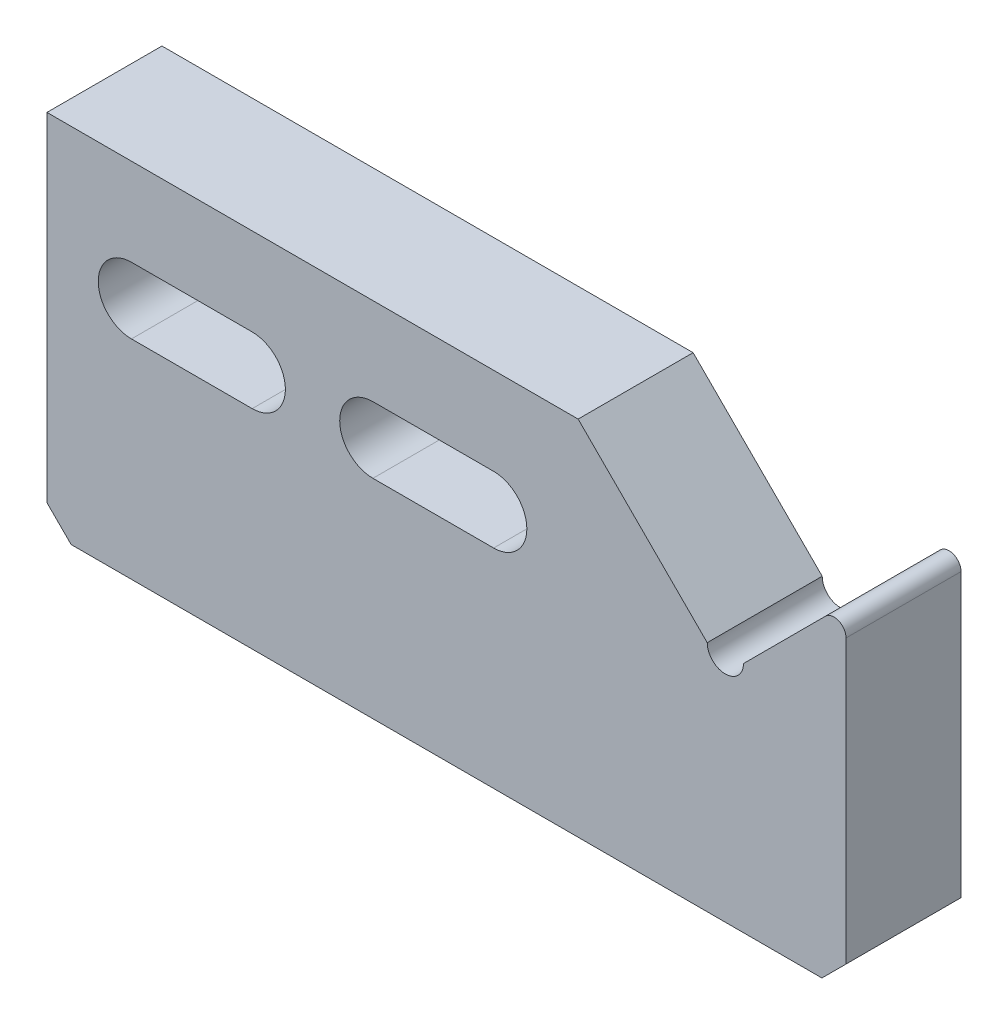
from build123d import *

# Parameters (mm, degrees)
BOSS_EXTRUDE1_DEPTH      = 6
BOSS_EXTRUDE1_DEPTH_BACK = 3.525
FILLET1_R                = 1
CHAMFER1_SIZE            = 2
CHAMFER2_SIZE            = 0.5


with BuildPart() as part:
    # Sketch1 → Boss-Extrude1 (new, two sides: drawn at the far end of the back side and taken through both)
    with BuildSketch(Plane.XY.offset(-BOSS_EXTRUDE1_DEPTH_BACK)):
        with BuildLine():
            Line((-10, 267.218866814), (-18.5, 258.718866814))
            ThreePointArc((-18.5, 258.718866814), (-20, 257.218866814), (-21.5, 258.718866814))
            Line((-21.5, 258.718866814), (-32.192388155, 269.41125497))
            Line((-32.192388155, 269.41125497), (-76.192388155, 269.41125497))
            Line((-76.192388155, 269.41125497), (-76.192388155, 239.41125497))
            Line((-76.192388155, 239.41125497), (-10, 239.41125497))
            Line((-10, 239.41125497), (-10, 267.218866814))
        make_face()
        with BuildLine():
            Line((-59.192388155, 262.16125497), (-69.192388155, 262.16125497))
            ThreePointArc((-69.192388155, 262.16125497), (-71.942388155, 259.41125497), (-69.192388155, 256.66125497))
            Line((-69.192388155, 256.66125497), (-59.192388155, 256.66125497))
            ThreePointArc((-59.192388155, 256.66125497), (-56.442388155, 259.41125497), (-59.192388155, 262.16125497))
        make_face(mode=Mode.SUBTRACT)
        with BuildLine():
            Line((-39.192388155, 262.16125497), (-49.192388155, 262.16125497))
            ThreePointArc((-49.192388155, 262.16125497), (-51.942388155, 259.41125497), (-49.192388155, 256.66125497))
            Line((-49.192388155, 256.66125497), (-39.192388155, 256.66125497))
            ThreePointArc((-39.192388155, 256.66125497), (-36.442388155, 259.41125497), (-39.192388155, 262.16125497))
        make_face(mode=Mode.SUBTRACT)
    extrude(amount=BOSS_EXTRUDE1_DEPTH + BOSS_EXTRUDE1_DEPTH_BACK)

    # Fillet1
    fillet1_edges = [part.edges().sort_by_distance(p)[0] for p in [
        (-10, 267.218866814, 1.2375),
    ]]
    fillet(fillet1_edges, radius=FILLET1_R)

    # Chamfer1
    chamfer1_edges = [part.edges().sort_by_distance(p)[0] for p in [
        (-76.192388155, 239.41125497, 1.2375),
        (-10, 239.41125497, 1.2375),
    ]]
    chamfer(chamfer1_edges, length=CHAMFER1_SIZE)

    # Sketch3 → Cut-Revolve1 (revolve, cut)
    with BuildSketch(Plane(origin=(0, 0, 1.2375), x_dir=(-1, 0, 0), z_dir=(0, 0, -1))):
        Polygon((76.192388155, 250.91125497), (56.192388155, 250.91125497), (55.326362752, 249.41125497), (76.192388155, 249.41125497), align=None)
    revolve(axis=Axis((-76.192388155, 249.41125497, 1.2375), (-1, 0, 0)), mode=Mode.SUBTRACT)

    # Chamfer2
    chamfer2_edges = [part.edges().sort_by_distance(p)[0] for p in [
        (-76.192388155, 247.91125497, 1.2375),
    ]]
    chamfer(chamfer2_edges, length=CHAMFER2_SIZE)


solid = part.part
